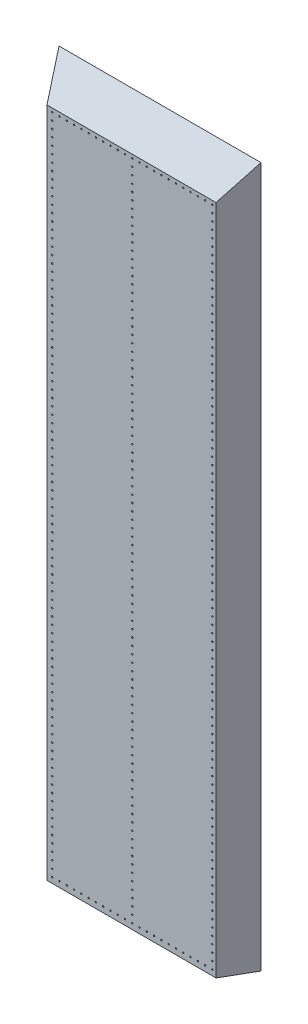
from build123d import *

# Parameters (mm, degrees)
BOSS_EXTRUDE1_DEPTH = 4809
CHAMFER1_SIZE       = 196
SKETCH3_R           = 4.7625
CUT_EXTRUDE1_DEPTH  = 4863.735942175


with BuildPart() as part:
    # Sketch2 → Boss-Extrude1 (new body)
    with BuildSketch(Plane(origin=(0, 0, 0), x_dir=(1, 0, 0), z_dir=(0, 1, 0))):
        Polygon((-580.6, 0), (580.6, 0), (693.760652761, 196), (-693.760652761, 196), align=None)
    extrude(amount=-BOSS_EXTRUDE1_DEPTH)

    # Chamfer1
    chamfer1_edges = [part.edges().sort_by_distance(p)[0] for p in [
        (0, 0, 0),
    ]]
    chamfer(chamfer1_edges, length=CHAMFER1_SIZE - 0.0001)  # a hair under: the kernel refuses the full size

    # Sketch3 → Cut-Extrude1 (cut, through all)
    with BuildSketch(Plane.XY):
        with Locations((-544.4, -221)):
            Circle(SKETCH3_R)
        with Locations((-494.4, -221)):
            Circle(SKETCH3_R)
        with Locations((-444.4, -221)):
            Circle(SKETCH3_R)
        with Locations((-394.4, -221)):
            Circle(SKETCH3_R)
        with Locations((-344.4, -221)):
            Circle(SKETCH3_R)
        with Locations((-294.4, -221)):
            Circle(SKETCH3_R)
        with Locations((-244.4, -221)):
            Circle(SKETCH3_R)
        with Locations((-194.4, -221)):
            Circle(SKETCH3_R)
        with Locations((-144.4, -221)):
            Circle(SKETCH3_R)
        with Locations((-94.4, -221)):
            Circle(SKETCH3_R)
        with Locations((-44.4, -221)):
            Circle(SKETCH3_R)
        with Locations((5.6, -221)):
            Circle(SKETCH3_R)
        with Locations((55.6, -221)):
            Circle(SKETCH3_R)
        with Locations((105.6, -221)):
            Circle(SKETCH3_R)
        with Locations((155.6, -221)):
            Circle(SKETCH3_R)
        with Locations((205.6, -221)):
            Circle(SKETCH3_R)
        with Locations((255.6, -221)):
            Circle(SKETCH3_R)
        with Locations((305.6, -221)):
            Circle(SKETCH3_R)
        with Locations((355.6, -221)):
            Circle(SKETCH3_R)
        with Locations((405.6, -221)):
            Circle(SKETCH3_R)
        with Locations((455.6, -221)):
            Circle(SKETCH3_R)
        with Locations((505.6, -221)):
            Circle(SKETCH3_R)
        with Locations((555.6, -221)):
            Circle(SKETCH3_R)
        with Locations((-494.4, -4771)):
            Circle(SKETCH3_R)
        with Locations((-444.4, -4771)):
            Circle(SKETCH3_R)
        with Locations((-394.4, -4771)):
            Circle(SKETCH3_R)
        with Locations((-344.4, -4771)):
            Circle(SKETCH3_R)
        with Locations((-294.4, -4771)):
            Circle(SKETCH3_R)
        with Locations((-244.4, -4771)):
            Circle(SKETCH3_R)
        with Locations((-194.4, -4771)):
            Circle(SKETCH3_R)
        with Locations((-144.4, -4771)):
            Circle(SKETCH3_R)
        with Locations((-94.4, -4771)):
            Circle(SKETCH3_R)
        with Locations((-44.4, -4771)):
            Circle(SKETCH3_R)
        with Locations((5.6, -4771)):
            Circle(SKETCH3_R)
        with Locations((55.6, -4771)):
            Circle(SKETCH3_R)
        with Locations((105.6, -4771)):
            Circle(SKETCH3_R)
        with Locations((155.6, -4771)):
            Circle(SKETCH3_R)
        with Locations((205.6, -4771)):
            Circle(SKETCH3_R)
        with Locations((255.6, -4771)):
            Circle(SKETCH3_R)
        with Locations((305.6, -4771)):
            Circle(SKETCH3_R)
        with Locations((355.6, -4771)):
            Circle(SKETCH3_R)
        with Locations((405.6, -4771)):
            Circle(SKETCH3_R)
        with Locations((455.6, -4771)):
            Circle(SKETCH3_R)
        with Locations((505.6, -4771)):
            Circle(SKETCH3_R)
        with Locations((555.6, -4771)):
            Circle(SKETCH3_R)
        with Locations((-544.4, -4771)):
            Circle(SKETCH3_R)
        with Locations((5.6, -271)):
            Circle(SKETCH3_R)
        with Locations((555.6, -271)):
            Circle(SKETCH3_R)
        with Locations((5.6, -321)):
            Circle(SKETCH3_R)
        with Locations((555.6, -321)):
            Circle(SKETCH3_R)
        with Locations((5.6, -371)):
            Circle(SKETCH3_R)
        with Locations((555.6, -371)):
            Circle(SKETCH3_R)
        with Locations((5.6, -421)):
            Circle(SKETCH3_R)
        with Locations((555.6, -421)):
            Circle(SKETCH3_R)
        with Locations((5.6, -471)):
            Circle(SKETCH3_R)
        with Locations((555.6, -471)):
            Circle(SKETCH3_R)
        with Locations((5.6, -521)):
            Circle(SKETCH3_R)
        with Locations((555.6, -521)):
            Circle(SKETCH3_R)
        with Locations((5.6, -571)):
            Circle(SKETCH3_R)
        with Locations((555.6, -571)):
            Circle(SKETCH3_R)
        with Locations((5.6, -621)):
            Circle(SKETCH3_R)
        with Locations((555.6, -621)):
            Circle(SKETCH3_R)
        with Locations((5.6, -671)):
            Circle(SKETCH3_R)
        with Locations((555.6, -671)):
            Circle(SKETCH3_R)
        with Locations((5.6, -721)):
            Circle(SKETCH3_R)
        with Locations((555.6, -721)):
            Circle(SKETCH3_R)
        with Locations((5.6, -771)):
            Circle(SKETCH3_R)
        with Locations((555.6, -771)):
            Circle(SKETCH3_R)
        with Locations((5.6, -821)):
            Circle(SKETCH3_R)
        with Locations((555.6, -821)):
            Circle(SKETCH3_R)
        with Locations((5.6, -871)):
            Circle(SKETCH3_R)
        with Locations((555.6, -871)):
            Circle(SKETCH3_R)
        with Locations((5.6, -921)):
            Circle(SKETCH3_R)
        with Locations((555.6, -921)):
            Circle(SKETCH3_R)
        with Locations((5.6, -971)):
            Circle(SKETCH3_R)
        with Locations((555.6, -971)):
            Circle(SKETCH3_R)
        with Locations((5.6, -1021)):
            Circle(SKETCH3_R)
        with Locations((555.6, -1021)):
            Circle(SKETCH3_R)
        with Locations((5.6, -1071)):
            Circle(SKETCH3_R)
        with Locations((555.6, -1071)):
            Circle(SKETCH3_R)
        with Locations((5.6, -1121)):
            Circle(SKETCH3_R)
        with Locations((555.6, -1121)):
            Circle(SKETCH3_R)
        with Locations((5.6, -1171)):
            Circle(SKETCH3_R)
        with Locations((555.6, -1171)):
            Circle(SKETCH3_R)
        with Locations((5.6, -1221)):
            Circle(SKETCH3_R)
        with Locations((555.6, -1221)):
            Circle(SKETCH3_R)
        with Locations((5.6, -1271)):
            Circle(SKETCH3_R)
        with Locations((555.6, -1271)):
            Circle(SKETCH3_R)
        with Locations((5.6, -1321)):
            Circle(SKETCH3_R)
        with Locations((555.6, -1321)):
            Circle(SKETCH3_R)
        with Locations((5.6, -1371)):
            Circle(SKETCH3_R)
        with Locations((555.6, -1371)):
            Circle(SKETCH3_R)
        with Locations((5.6, -1421)):
            Circle(SKETCH3_R)
        with Locations((555.6, -1421)):
            Circle(SKETCH3_R)
        with Locations((5.6, -1471)):
            Circle(SKETCH3_R)
        with Locations((555.6, -1471)):
            Circle(SKETCH3_R)
        with Locations((5.6, -1521)):
            Circle(SKETCH3_R)
        with Locations((555.6, -1521)):
            Circle(SKETCH3_R)
        with Locations((5.6, -1571)):
            Circle(SKETCH3_R)
        with Locations((555.6, -1571)):
            Circle(SKETCH3_R)
        with Locations((5.6, -1621)):
            Circle(SKETCH3_R)
        with Locations((555.6, -1621)):
            Circle(SKETCH3_R)
        with Locations((5.6, -1671)):
            Circle(SKETCH3_R)
        with Locations((555.6, -1671)):
            Circle(SKETCH3_R)
        with Locations((5.6, -1721)):
            Circle(SKETCH3_R)
        with Locations((555.6, -1721)):
            Circle(SKETCH3_R)
        with Locations((5.6, -1771)):
            Circle(SKETCH3_R)
        with Locations((555.6, -1771)):
            Circle(SKETCH3_R)
        with Locations((5.6, -1821)):
            Circle(SKETCH3_R)
        with Locations((555.6, -1821)):
            Circle(SKETCH3_R)
        with Locations((5.6, -1871)):
            Circle(SKETCH3_R)
        with Locations((555.6, -1871)):
            Circle(SKETCH3_R)
        with Locations((5.6, -1921)):
            Circle(SKETCH3_R)
        with Locations((555.6, -1921)):
            Circle(SKETCH3_R)
        with Locations((5.6, -1971)):
            Circle(SKETCH3_R)
        with Locations((555.6, -1971)):
            Circle(SKETCH3_R)
        with Locations((5.6, -2021)):
            Circle(SKETCH3_R)
        with Locations((555.6, -2021)):
            Circle(SKETCH3_R)
        with Locations((5.6, -2071)):
            Circle(SKETCH3_R)
        with Locations((555.6, -2071)):
            Circle(SKETCH3_R)
        with Locations((5.6, -2121)):
            Circle(SKETCH3_R)
        with Locations((555.6, -2121)):
            Circle(SKETCH3_R)
        with Locations((5.6, -2171)):
            Circle(SKETCH3_R)
        with Locations((555.6, -2171)):
            Circle(SKETCH3_R)
        with Locations((5.6, -2221)):
            Circle(SKETCH3_R)
        with Locations((555.6, -2221)):
            Circle(SKETCH3_R)
        with Locations((5.6, -2271)):
            Circle(SKETCH3_R)
        with Locations((555.6, -2271)):
            Circle(SKETCH3_R)
        with Locations((5.6, -2321)):
            Circle(SKETCH3_R)
        with Locations((555.6, -2321)):
            Circle(SKETCH3_R)
        with Locations((5.6, -2371)):
            Circle(SKETCH3_R)
        with Locations((555.6, -2371)):
            Circle(SKETCH3_R)
        with Locations((5.6, -2421)):
            Circle(SKETCH3_R)
        with Locations((555.6, -2421)):
            Circle(SKETCH3_R)
        with Locations((5.6, -2471)):
            Circle(SKETCH3_R)
        with Locations((555.6, -2471)):
            Circle(SKETCH3_R)
        with Locations((5.6, -2521)):
            Circle(SKETCH3_R)
        with Locations((555.6, -2521)):
            Circle(SKETCH3_R)
        with Locations((5.6, -2571)):
            Circle(SKETCH3_R)
        with Locations((555.6, -2571)):
            Circle(SKETCH3_R)
        with Locations((5.6, -2621)):
            Circle(SKETCH3_R)
        with Locations((555.6, -2621)):
            Circle(SKETCH3_R)
        with Locations((5.6, -2671)):
            Circle(SKETCH3_R)
        with Locations((555.6, -2671)):
            Circle(SKETCH3_R)
        with Locations((5.6, -2721)):
            Circle(SKETCH3_R)
        with Locations((555.6, -2721)):
            Circle(SKETCH3_R)
        with Locations((5.6, -2771)):
            Circle(SKETCH3_R)
        with Locations((555.6, -2771)):
            Circle(SKETCH3_R)
        with Locations((5.6, -2821)):
            Circle(SKETCH3_R)
        with Locations((555.6, -2821)):
            Circle(SKETCH3_R)
        with Locations((5.6, -2871)):
            Circle(SKETCH3_R)
        with Locations((555.6, -2871)):
            Circle(SKETCH3_R)
        with Locations((5.6, -2921)):
            Circle(SKETCH3_R)
        with Locations((555.6, -2921)):
            Circle(SKETCH3_R)
        with Locations((5.6, -2971)):
            Circle(SKETCH3_R)
        with Locations((555.6, -2971)):
            Circle(SKETCH3_R)
        with Locations((5.6, -3021)):
            Circle(SKETCH3_R)
        with Locations((555.6, -3021)):
            Circle(SKETCH3_R)
        with Locations((5.6, -3071)):
            Circle(SKETCH3_R)
        with Locations((555.6, -3071)):
            Circle(SKETCH3_R)
        with Locations((5.6, -3121)):
            Circle(SKETCH3_R)
        with Locations((555.6, -3121)):
            Circle(SKETCH3_R)
        with Locations((5.6, -3171)):
            Circle(SKETCH3_R)
        with Locations((555.6, -3171)):
            Circle(SKETCH3_R)
        with Locations((5.6, -3221)):
            Circle(SKETCH3_R)
        with Locations((555.6, -3221)):
            Circle(SKETCH3_R)
        with Locations((5.6, -3271)):
            Circle(SKETCH3_R)
        with Locations((555.6, -3271)):
            Circle(SKETCH3_R)
        with Locations((5.6, -3321)):
            Circle(SKETCH3_R)
        with Locations((555.6, -3321)):
            Circle(SKETCH3_R)
        with Locations((5.6, -3371)):
            Circle(SKETCH3_R)
        with Locations((555.6, -3371)):
            Circle(SKETCH3_R)
        with Locations((5.6, -3421)):
            Circle(SKETCH3_R)
        with Locations((555.6, -3421)):
            Circle(SKETCH3_R)
        with Locations((5.6, -3471)):
            Circle(SKETCH3_R)
        with Locations((555.6, -3471)):
            Circle(SKETCH3_R)
        with Locations((5.6, -3521)):
            Circle(SKETCH3_R)
        with Locations((555.6, -3521)):
            Circle(SKETCH3_R)
        with Locations((5.6, -3571)):
            Circle(SKETCH3_R)
        with Locations((555.6, -3571)):
            Circle(SKETCH3_R)
        with Locations((5.6, -3621)):
            Circle(SKETCH3_R)
        with Locations((555.6, -3621)):
            Circle(SKETCH3_R)
        with Locations((5.6, -3671)):
            Circle(SKETCH3_R)
        with Locations((555.6, -3671)):
            Circle(SKETCH3_R)
        with Locations((5.6, -3721)):
            Circle(SKETCH3_R)
        with Locations((555.6, -3721)):
            Circle(SKETCH3_R)
        with Locations((5.6, -3771)):
            Circle(SKETCH3_R)
        with Locations((555.6, -3771)):
            Circle(SKETCH3_R)
        with Locations((5.6, -3821)):
            Circle(SKETCH3_R)
        with Locations((555.6, -3821)):
            Circle(SKETCH3_R)
        with Locations((5.6, -3871)):
            Circle(SKETCH3_R)
        with Locations((555.6, -3871)):
            Circle(SKETCH3_R)
        with Locations((5.6, -3921)):
            Circle(SKETCH3_R)
        with Locations((555.6, -3921)):
            Circle(SKETCH3_R)
        with Locations((5.6, -3971)):
            Circle(SKETCH3_R)
        with Locations((555.6, -3971)):
            Circle(SKETCH3_R)
        with Locations((5.6, -4021)):
            Circle(SKETCH3_R)
        with Locations((555.6, -4021)):
            Circle(SKETCH3_R)
        with Locations((5.6, -4071)):
            Circle(SKETCH3_R)
        with Locations((555.6, -4071)):
            Circle(SKETCH3_R)
        with Locations((5.6, -4121)):
            Circle(SKETCH3_R)
        with Locations((555.6, -4121)):
            Circle(SKETCH3_R)
        with Locations((5.6, -4171)):
            Circle(SKETCH3_R)
        with Locations((555.6, -4171)):
            Circle(SKETCH3_R)
        with Locations((5.6, -4221)):
            Circle(SKETCH3_R)
        with Locations((555.6, -4221)):
            Circle(SKETCH3_R)
        with Locations((5.6, -4271)):
            Circle(SKETCH3_R)
        with Locations((555.6, -4271)):
            Circle(SKETCH3_R)
        with Locations((5.6, -4321)):
            Circle(SKETCH3_R)
        with Locations((555.6, -4321)):
            Circle(SKETCH3_R)
        with Locations((5.6, -4371)):
            Circle(SKETCH3_R)
        with Locations((555.6, -4371)):
            Circle(SKETCH3_R)
        with Locations((5.6, -4421)):
            Circle(SKETCH3_R)
        with Locations((555.6, -4421)):
            Circle(SKETCH3_R)
        with Locations((5.6, -4471)):
            Circle(SKETCH3_R)
        with Locations((555.6, -4471)):
            Circle(SKETCH3_R)
        with Locations((5.6, -4521)):
            Circle(SKETCH3_R)
        with Locations((555.6, -4521)):
            Circle(SKETCH3_R)
        with Locations((5.6, -4571)):
            Circle(SKETCH3_R)
        with Locations((555.6, -4571)):
            Circle(SKETCH3_R)
        with Locations((5.6, -4621)):
            Circle(SKETCH3_R)
        with Locations((555.6, -4621)):
            Circle(SKETCH3_R)
        with Locations((5.6, -4671)):
            Circle(SKETCH3_R)
        with Locations((555.6, -4671)):
            Circle(SKETCH3_R)
        with Locations((5.6, -4721)):
            Circle(SKETCH3_R)
        with Locations((555.6, -4721)):
            Circle(SKETCH3_R)
        with Locations((-544.4, -271)):
            Circle(SKETCH3_R)
        with Locations((-544.4, -321)):
            Circle(SKETCH3_R)
        with Locations((-544.4, -371)):
            Circle(SKETCH3_R)
        with Locations((-544.4, -421)):
            Circle(SKETCH3_R)
        with Locations((-544.4, -471)):
            Circle(SKETCH3_R)
        with Locations((-544.4, -521)):
            Circle(SKETCH3_R)
        with Locations((-544.4, -571)):
            Circle(SKETCH3_R)
        with Locations((-544.4, -621)):
            Circle(SKETCH3_R)
        with Locations((-544.4, -671)):
            Circle(SKETCH3_R)
        with Locations((-544.4, -721)):
            Circle(SKETCH3_R)
        with Locations((-544.4, -771)):
            Circle(SKETCH3_R)
        with Locations((-544.4, -821)):
            Circle(SKETCH3_R)
        with Locations((-544.4, -871)):
            Circle(SKETCH3_R)
        with Locations((-544.4, -921)):
            Circle(SKETCH3_R)
        with Locations((-544.4, -971)):
            Circle(SKETCH3_R)
        with Locations((-544.4, -1021)):
            Circle(SKETCH3_R)
        with Locations((-544.4, -1071)):
            Circle(SKETCH3_R)
        with Locations((-544.4, -1121)):
            Circle(SKETCH3_R)
        with Locations((-544.4, -1171)):
            Circle(SKETCH3_R)
        with Locations((-544.4, -1221)):
            Circle(SKETCH3_R)
        with Locations((-544.4, -1271)):
            Circle(SKETCH3_R)
        with Locations((-544.4, -1321)):
            Circle(SKETCH3_R)
        with Locations((-544.4, -1371)):
            Circle(SKETCH3_R)
        with Locations((-544.4, -1421)):
            Circle(SKETCH3_R)
        with Locations((-544.4, -1471)):
            Circle(SKETCH3_R)
        with Locations((-544.4, -1521)):
            Circle(SKETCH3_R)
        with Locations((-544.4, -1571)):
            Circle(SKETCH3_R)
        with Locations((-544.4, -1621)):
            Circle(SKETCH3_R)
        with Locations((-544.4, -1671)):
            Circle(SKETCH3_R)
        with Locations((-544.4, -1721)):
            Circle(SKETCH3_R)
        with Locations((-544.4, -1771)):
            Circle(SKETCH3_R)
        with Locations((-544.4, -1821)):
            Circle(SKETCH3_R)
        with Locations((-544.4, -1871)):
            Circle(SKETCH3_R)
        with Locations((-544.4, -1921)):
            Circle(SKETCH3_R)
        with Locations((-544.4, -1971)):
            Circle(SKETCH3_R)
        with Locations((-544.4, -2021)):
            Circle(SKETCH3_R)
        with Locations((-544.4, -2071)):
            Circle(SKETCH3_R)
        with Locations((-544.4, -2121)):
            Circle(SKETCH3_R)
        with Locations((-544.4, -2171)):
            Circle(SKETCH3_R)
        with Locations((-544.4, -2221)):
            Circle(SKETCH3_R)
        with Locations((-544.4, -2271)):
            Circle(SKETCH3_R)
        with Locations((-544.4, -2321)):
            Circle(SKETCH3_R)
        with Locations((-544.4, -2371)):
            Circle(SKETCH3_R)
        with Locations((-544.4, -2421)):
            Circle(SKETCH3_R)
        with Locations((-544.4, -2471)):
            Circle(SKETCH3_R)
        with Locations((-544.4, -2521)):
            Circle(SKETCH3_R)
        with Locations((-544.4, -2571)):
            Circle(SKETCH3_R)
        with Locations((-544.4, -2621)):
            Circle(SKETCH3_R)
        with Locations((-544.4, -2671)):
            Circle(SKETCH3_R)
        with Locations((-544.4, -2721)):
            Circle(SKETCH3_R)
        with Locations((-544.4, -2771)):
            Circle(SKETCH3_R)
        with Locations((-544.4, -2821)):
            Circle(SKETCH3_R)
        with Locations((-544.4, -2871)):
            Circle(SKETCH3_R)
        with Locations((-544.4, -2921)):
            Circle(SKETCH3_R)
        with Locations((-544.4, -2971)):
            Circle(SKETCH3_R)
        with Locations((-544.4, -3021)):
            Circle(SKETCH3_R)
        with Locations((-544.4, -3071)):
            Circle(SKETCH3_R)
        with Locations((-544.4, -3121)):
            Circle(SKETCH3_R)
        with Locations((-544.4, -3171)):
            Circle(SKETCH3_R)
        with Locations((-544.4, -3221)):
            Circle(SKETCH3_R)
        with Locations((-544.4, -3271)):
            Circle(SKETCH3_R)
        with Locations((-544.4, -3321)):
            Circle(SKETCH3_R)
        with Locations((-544.4, -3371)):
            Circle(SKETCH3_R)
        with Locations((-544.4, -3421)):
            Circle(SKETCH3_R)
        with Locations((-544.4, -3471)):
            Circle(SKETCH3_R)
        with Locations((-544.4, -3521)):
            Circle(SKETCH3_R)
        with Locations((-544.4, -3571)):
            Circle(SKETCH3_R)
        with Locations((-544.4, -3621)):
            Circle(SKETCH3_R)
        with Locations((-544.4, -3671)):
            Circle(SKETCH3_R)
        with Locations((-544.4, -3721)):
            Circle(SKETCH3_R)
        with Locations((-544.4, -3771)):
            Circle(SKETCH3_R)
        with Locations((-544.4, -3821)):
            Circle(SKETCH3_R)
        with Locations((-544.4, -3871)):
            Circle(SKETCH3_R)
        with Locations((-544.4, -3921)):
            Circle(SKETCH3_R)
        with Locations((-544.4, -3971)):
            Circle(SKETCH3_R)
        with Locations((-544.4, -4021)):
            Circle(SKETCH3_R)
        with Locations((-544.4, -4071)):
            Circle(SKETCH3_R)
        with Locations((-544.4, -4121)):
            Circle(SKETCH3_R)
        with Locations((-544.4, -4171)):
            Circle(SKETCH3_R)
        with Locations((-544.4, -4221)):
            Circle(SKETCH3_R)
        with Locations((-544.4, -4271)):
            Circle(SKETCH3_R)
        with Locations((-544.4, -4321)):
            Circle(SKETCH3_R)
        with Locations((-544.4, -4371)):
            Circle(SKETCH3_R)
        with Locations((-544.4, -4421)):
            Circle(SKETCH3_R)
        with Locations((-544.4, -4471)):
            Circle(SKETCH3_R)
        with Locations((-544.4, -4521)):
            Circle(SKETCH3_R)
        with Locations((-544.4, -4571)):
            Circle(SKETCH3_R)
        with Locations((-544.4, -4621)):
            Circle(SKETCH3_R)
        with Locations((-544.4, -4671)):
            Circle(SKETCH3_R)
        with Locations((-544.4, -4721)):
            Circle(SKETCH3_R)
    extrude(amount=-CUT_EXTRUDE1_DEPTH, mode=Mode.SUBTRACT)


solid = part.part
